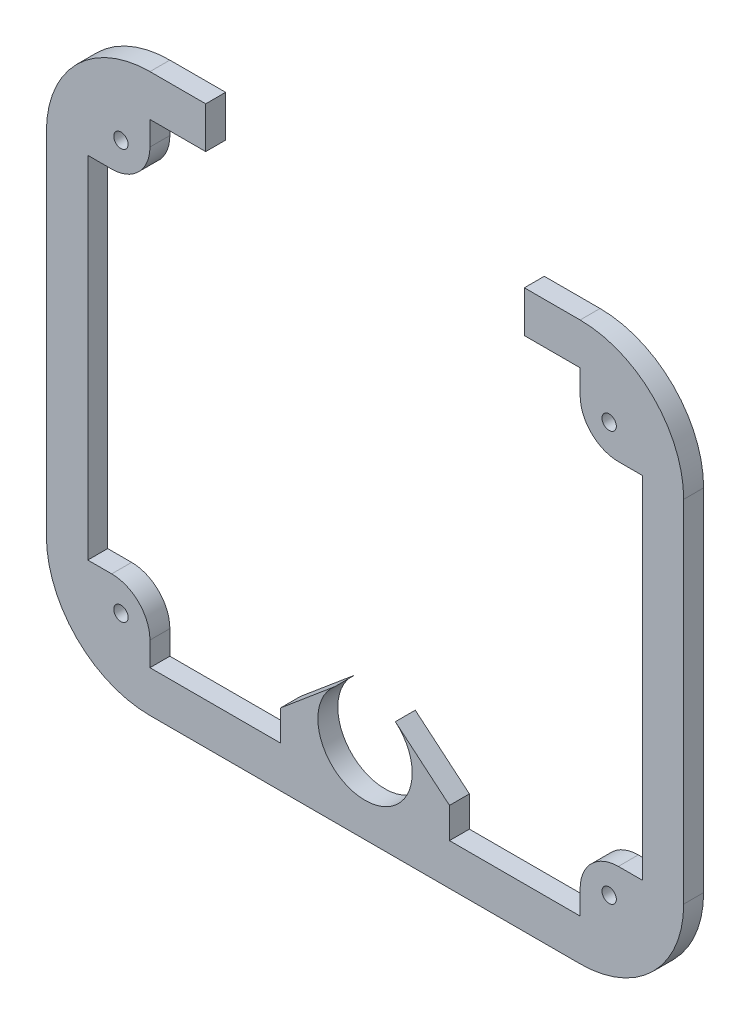
from build123d import *

# Parameters (mm, degrees)
SKETCH1_R           = 0.5715
BOSS_EXTRUDE1_DEPTH = 1.5875
CUT_EXTRUDE1_REACH  = 35.788
SKETCH2_W           = 2.901094666
SKETCH2_H           = 2.434307465
SKETCH2_W_2         = 25.4
SKETCH2_H_2         = 3.302
FILLET1_R           = 3.048


with BuildPart() as part:
    # Sketch1 → Boss-Extrude1 (new body)
    with BuildSketch(Plane.XY):
        with BuildLine():
            Line((17.145, 22.225), (-17.145, 22.225))
            ThreePointArc((-17.145, 22.225), (-22.982166479, 19.807166479), (-25.4, 13.97))
            Line((-25.4, 13.97), (-25.4, -13.97))
            ThreePointArc((-25.4, -13.97), (-22.982166479, -19.807166479), (-17.145, -22.225))
            Line((-17.145, -22.225), (17.145, -22.225))
            ThreePointArc((17.145, -22.225), (22.982166479, -19.807166479), (25.4, -13.97))
            Line((25.4, -13.97), (25.4, 13.97))
            ThreePointArc((25.4, 13.97), (22.982166479, 19.807166479), (17.145, 22.225))
        make_face()
        with Locations((-19.457528855, 16.326805286)):
            Circle(SKETCH1_R, mode=Mode.SUBTRACT)
        with Locations((19.457528855, 16.326805286)):
            Circle(SKETCH1_R, mode=Mode.SUBTRACT)
        with Locations((-19.457528855, -16.326805286)):
            Circle(SKETCH1_R, mode=Mode.SUBTRACT)
        with Locations((19.457528855, -16.326805286)):
            Circle(SKETCH1_R, mode=Mode.SUBTRACT)
        with BuildLine():
            Line((-17.145, -18.923), (-9.632094666, -18.923))
            Line((-9.632094666, -18.923), (-2.416367182, -12.868285729))
            ThreePointArc((-2.416367182, -12.868285729), (0, -19.5072), (2.416367182, -12.868285729))
            Line((2.416367182, -12.868285729), (9.632094666, -18.923))
            Line((9.632094666, -18.923), (17.145, -18.923))
            Line((17.145, -18.923), (17.145, -13.97))
            Line((17.145, -13.97), (22.098, -13.97))
            Line((22.098, -13.97), (22.098, 13.97))
            Line((22.098, 13.97), (17.145, 13.97))
            Line((17.145, 13.97), (17.145, 18.923))
            Line((17.145, 18.923), (-17.145, 18.923))
            Line((-17.145, 18.923), (-17.145, 13.97))
            Line((-17.145, 13.97), (-22.098, 13.97))
            Line((-22.098, 13.97), (-22.098, -13.97))
            Line((-22.098, -13.97), (-17.145, -13.97))
            Line((-17.145, -13.97), (-17.145, -18.923))
        make_face(mode=Mode.SUBTRACT)
    extrude(amount=BOSS_EXTRUDE1_DEPTH)

    # Sketch2 → Cut-Extrude1 (cut, up to next)
    with BuildSketch(Plane.XY.offset(1.5875), mode=Mode.PRIVATE) as cut_extrude1_sk1:
        with Locations((-8.181547333, -17.705846268)):
            Rectangle(SKETCH2_W, SKETCH2_H)
    cut_extrude1_tool1 = extrude(cut_extrude1_sk1.sketch, amount=-CUT_EXTRUDE1_REACH, mode=Mode.PRIVATE) & part.part
    # Sketch2 → Cut-Extrude1 (cut, up to next)
    with BuildSketch(Plane.XY.offset(1.5875), mode=Mode.PRIVATE) as cut_extrude1_sk2:
        with Locations((8.181547333, -17.705846268)):
            Rectangle(SKETCH2_W, SKETCH2_H)
    cut_extrude1_tool2 = extrude(cut_extrude1_sk2.sketch, amount=-CUT_EXTRUDE1_REACH, mode=Mode.PRIVATE) & part.part
    # Sketch2 → Cut-Extrude1 (cut, up to next)
    with BuildSketch(Plane.XY.offset(1.5875), mode=Mode.PRIVATE) as cut_extrude1_sk3:
        with Locations((0, 20.574)):
            Rectangle(SKETCH2_W_2, SKETCH2_H_2)
    cut_extrude1_tool3 = extrude(cut_extrude1_sk3.sketch, amount=-CUT_EXTRUDE1_REACH, mode=Mode.PRIVATE) & part.part
    add(cut_extrude1_tool1.solids().sort_by_distance((-8.181547, -17.705846, 1.5875))[0], mode=Mode.SUBTRACT)
    add(cut_extrude1_tool2.solids().sort_by_distance((8.181547, -17.705846, 1.5875))[0], mode=Mode.SUBTRACT)
    add(cut_extrude1_tool3.solids().sort_by_distance((0, 20.574, 1.5875))[0], mode=Mode.SUBTRACT)

    # Fillet1
    fillet1_edges = [part.edges().sort_by_distance(p)[0] for p in [
        (17.145, 13.97, 0.79375),
        (17.145, -13.97, 0.79375),
        (-17.145, -13.97, 0.79375),
        (-17.145, 13.97, 0.79375),
    ]]
    fillet(fillet1_edges, radius=FILLET1_R)


solid = part.part
